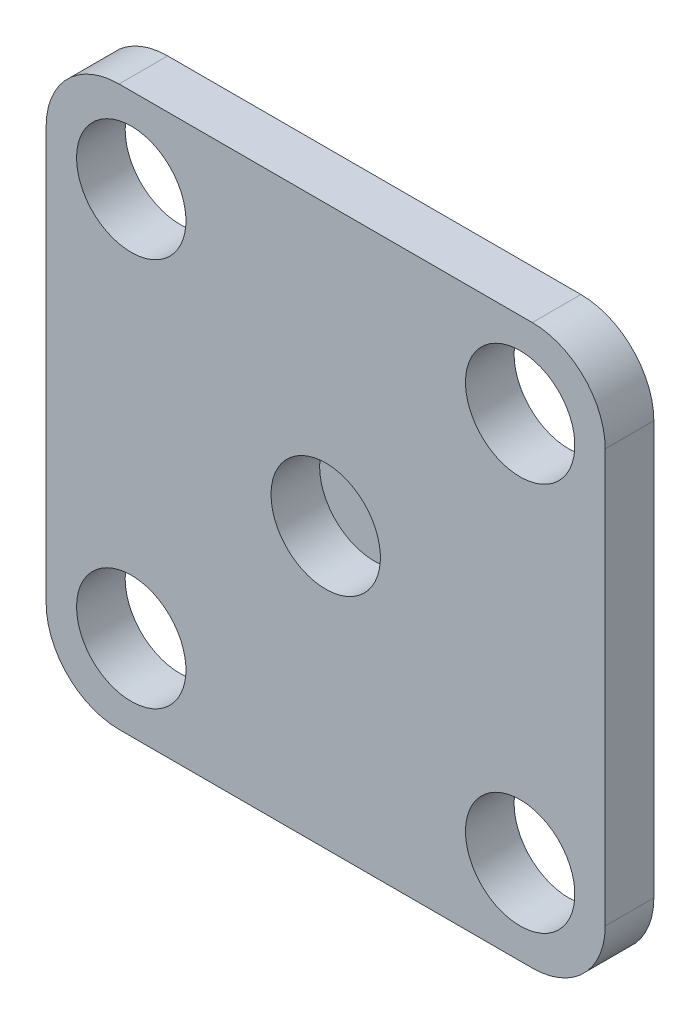
from build123d import *

# Parameters (mm, degrees)
SKETCH_1_W                 = 23
SKETCH_1_H                 = 23
EXTRUDE_1_DEPTH            = 2
SKETCH_2_W                 = 7
SKETCH_2_H                 = 7
EXTRUDE_2_DEPTH            = 1.5
FILLET_1_R                 = 3
HOLE_WIZARD_M4_1_OUTLINE_R = 2.25
HOLE_WIZARD_M4_1_DEPTH     = 2


# Read off the part's stored shape, not the designer's step: M4 间隙孔1
with BuildPart() as part:
    # 草图1 → 凸台-拉伸1 (new body)
    with BuildSketch(Plane.XY):
        with Locations((11.5, 11.5)):
            Rectangle(SKETCH_1_W, SKETCH_1_H)
    extrude(amount=EXTRUDE_1_DEPTH)

    # 草图2 → 凸台-拉伸2 (add)
    with BuildSketch(Plane(origin=(0, 0, 0), x_dir=(-1, 0, 0), z_dir=(0, 0, -1))):
        with Locations((-11.5, 11.5)):
            Rectangle(SKETCH_2_W, SKETCH_2_H)
    extrude(amount=EXTRUDE_2_DEPTH)

    # 圆角1
    fillet_1_edges = [part.edges().sort_by_distance(p)[0] for p in [
        (0, 23, 1),
        (23, 23, 1),
        (23, 0, 1),
        (0, 0, 1),
    ]]
    fillet(fillet_1_edges, radius=FILLET_1_R)

    # M4 间隙孔1 outline → M4 间隙孔1 (cut)
    with BuildSketch(Plane.XY):
        with Locations((3.5, 3.5)):
            Circle(HOLE_WIZARD_M4_1_OUTLINE_R)
        with Locations((19.5, 19.5)):
            Circle(HOLE_WIZARD_M4_1_OUTLINE_R)
        with Locations((19.5, 3.5)):
            Circle(HOLE_WIZARD_M4_1_OUTLINE_R)
        with Locations((3.5, 19.5)):
            Circle(HOLE_WIZARD_M4_1_OUTLINE_R)
        with Locations((11.5, 11.5)):
            Circle(HOLE_WIZARD_M4_1_OUTLINE_R)
    extrude(amount=HOLE_WIZARD_M4_1_DEPTH, mode=Mode.SUBTRACT)


solid = part.part
